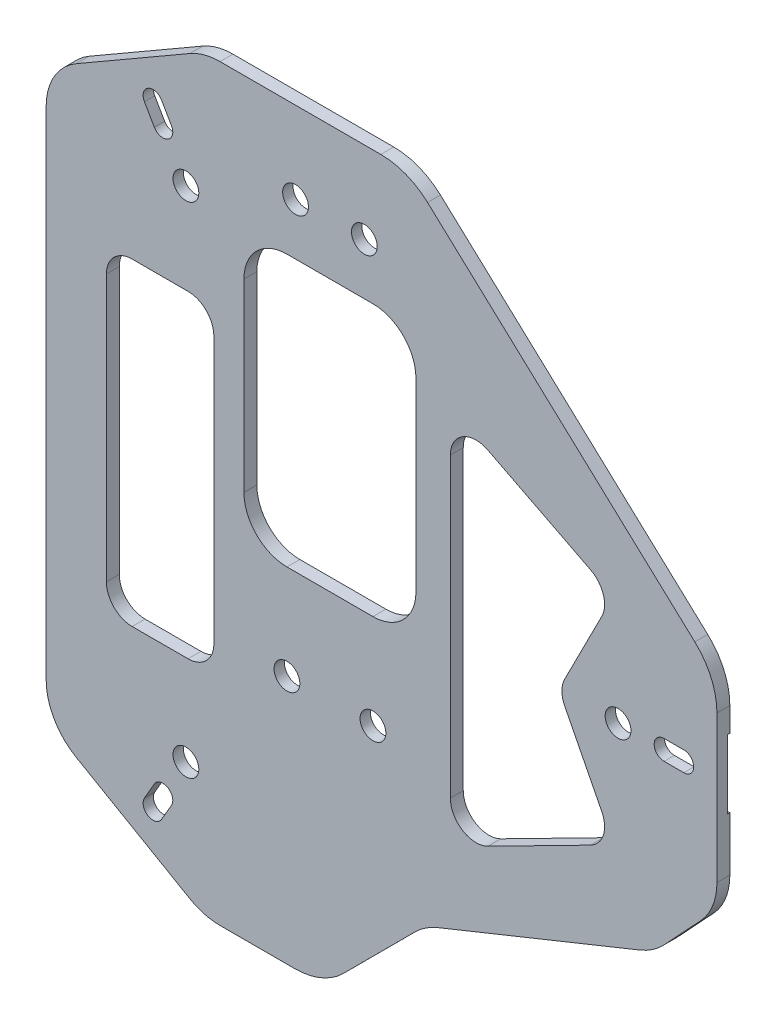
from build123d import *

# Parameters (mm, degrees)
BOSS_EXTRUDE1_DEPTH                     = 0.75
BOSS_EXTRUDE1_DEPTH_BACK                = 0.75
CORNER_RADIUS_7_R                       = 7
CORNER_RADIUS_8_R                       = 8
ALIGN_AXIS_REMAGE_ANGLE                 = 180
GROOVES_DEPTH                           = 0.3
COPPERROD_HOLES_REACH                   = 64.606
SKETCH6_R                               = 1.5
CIRPATTERN1_COUNT                       = 3
CUT_OUTS_REACH                          = 64.606
SKETCH7_W                               = 12.5
SKETCH7_H                               = 37
SKETCH7_W_2                             = 20
SKETCH7_H_2                             = 31.5
CORNER_CUTOUTS_3_R                      = 3
CORNER_CUTOUTS_5_R                      = 5
CBORE_FOR_M5_HEX_HEAD_BOLT1_D           = 3
CBORE_FOR_M5_HEX_HEAD_BOLT1_CBORE_D     = 4.5
CBORE_FOR_M5_HEX_HEAD_BOLT1_CBORE_DEPTH = 0.3


with BuildPart() as part:
    # Sketch3 → Boss-Extrude1 (new, two sides: drawn at the far end of the back side and taken through both)
    with BuildSketch(Plane.XY.offset(-BOSS_EXTRUDE1_DEPTH_BACK)):
        Polygon((-33, 0), (-33, 32.91), (-14.657581948, 43.5), (-0.777581948, 43.5), (11.04795908, 31.651617013), (37.661697646, 20.909228101), (45, 13.039862272), (45, -10.290137728), (9.052418052, -43.5), (-14.657581948, -43.5), (-33, -32.91), align=None)
    extrude(amount=BOSS_EXTRUDE1_DEPTH + BOSS_EXTRUDE1_DEPTH_BACK)

    # Corner_Radius_7
    corner_radius_7_edges = [part.edges().sort_by_distance(p)[0] for p in [
        (45, 13.039862272, 0),
        (-33, 32.91, 0),
        (-14.657581948, 43.5, 0),
        (-14.657581948, -43.5, 0),
        (-33, -32.91, 0),
    ]]
    fillet(corner_radius_7_edges, radius=CORNER_RADIUS_7_R)

    # Corner_Radius_8
    corner_radius_8_edges = [part.edges().sort_by_distance(p)[0] for p in [
        (9.052418052, -43.5, 0),
        (45, -10.290137728, 0),
        (37.661697646, 20.909228101, 0),
        (-0.777581948, 43.5, 0),
        (11.04795908, 31.651617013, 0),
    ]]
    fillet(corner_radius_8_edges, radius=CORNER_RADIUS_8_R)


with BuildPart() as part_1:
    # Align_axis_remage: moved
    add(part.part.rotate(Axis((0, 0, 0), (1, 0, 0)), ALIGN_AXIS_REMAGE_ANGLE))

    # Sketch5 → Grooves (cut)
    with BuildSketch(Plane.XY.offset(-0.75)):
        with BuildLine():
            Line((30, 2.5), (30, -2.5))
            ThreePointArc((30, -2.5), (30.439339828, -3.560660172), (31.5, -4))
            Line((31.5, -4), (45, -4))
            Line((45, -4), (45, 4))
            Line((45, 4), (31.5, 4))
            ThreePointArc((31.5, 4), (30.439339828, 3.560660172), (30, 2.5))
        make_face()
    grooves = extrude(amount=GROOVES_DEPTH, mode=Mode.SUBTRACT)

    # Sketch6 → CopperRod_Holes (cut, up to next)
    with BuildSketch(Plane.XY.offset(0.75), mode=Mode.PRIVATE) as copperrod_holes_sk1:
        with BuildLine():
            ThreePointArc((38.85, 1.15), (37.7, 0), (38.85, -1.15))
            Line((38.85, -1.15), (41.15, -1.15))
            ThreePointArc((41.15, -1.15), (42.3, 0), (41.15, 1.15))
            Line((41.15, 1.15), (38.85, 1.15))
        make_face()
    copperrod_holes_tool1 = extrude(copperrod_holes_sk1.sketch, amount=-COPPERROD_HOLES_REACH, mode=Mode.PRIVATE) & part_1.part
    # Sketch6 → CopperRod_Holes (cut, up to next)
    with BuildSketch(Plane.XY.offset(0.75), mode=Mode.PRIVATE) as copperrod_holes_sk2:
        with Locations((33.5, 0)):
            Circle(SKETCH6_R)
    copperrod_holes_tool2 = extrude(copperrod_holes_sk2.sketch, amount=-COPPERROD_HOLES_REACH, mode=Mode.PRIVATE) & part_1.part
    copperrod_holes_1 = copperrod_holes_tool1.solids().sort_by_distance((40, 0, 0.75))[0]
    add(copperrod_holes_1, mode=Mode.SUBTRACT)
    copperrod_holes_2 = copperrod_holes_tool2.solids().sort_by_distance((33.5, 0, 0.75))[0]
    add(copperrod_holes_2, mode=Mode.SUBTRACT)
    copperrod_holes = copperrod_holes_1 + copperrod_holes_2  # CopperRod_Holes as one shape, for the pattern or mirror that repeats it

    # CirPattern1: Grooves, CopperRod_Holes ×3 about axis
    cirpattern1_axis = Axis((0, 0, -0.825), (0, 0, 1))
    add([grooves.rotate(cirpattern1_axis, i * 360 / CIRPATTERN1_COUNT) for i in range(1, CIRPATTERN1_COUNT)], mode=Mode.SUBTRACT)
    add([copperrod_holes.rotate(cirpattern1_axis, i * 360 / CIRPATTERN1_COUNT) for i in range(1, CIRPATTERN1_COUNT)], mode=Mode.SUBTRACT)

    # Sketch7 → Cut-Outs (cut, up to next)
    with BuildSketch(Plane.XY.offset(0.75), mode=Mode.PRIVATE) as cut_outs_sk1:
        with Locations((-19.75, 0)):
            Rectangle(SKETCH7_W, SKETCH7_H)
    cut_outs_tool1 = extrude(cut_outs_sk1.sketch, amount=-CUT_OUTS_REACH, mode=Mode.PRIVATE) & part_1.part
    # Sketch7 → Cut-Outs (cut, up to next)
    with BuildSketch(Plane.XY.offset(0.75), mode=Mode.PRIVATE) as cut_outs_sk2:
        Polygon((14, 22.17), (14, -22.17), (32.9695289, -12.504542261), (26.607349804, 0), (32.9695289, 12.504542261), align=None)
    cut_outs_tool2 = extrude(cut_outs_sk2.sketch, amount=-CUT_OUTS_REACH, mode=Mode.PRIVATE) & part_1.part
    # Sketch7 → Cut-Outs (cut, up to next)
    with BuildSketch(Plane.XY.offset(0.75), mode=Mode.PRIVATE) as cut_outs_sk3:
        with Locations((0, 12.25)):
            Rectangle(SKETCH7_W_2, SKETCH7_H_2)
    cut_outs_tool3 = extrude(cut_outs_sk3.sketch, amount=-CUT_OUTS_REACH, mode=Mode.PRIVATE) & part_1.part
    add(cut_outs_tool1.solids().sort_by_distance((-19.75, 0, 0.75))[0], mode=Mode.SUBTRACT)
    add(cut_outs_tool2.solids().sort_by_distance((21.468988, 0, 0.75))[0], mode=Mode.SUBTRACT)
    add(cut_outs_tool3.solids().sort_by_distance((0, 12.25, 0.75))[0], mode=Mode.SUBTRACT)

    # Corner_CutOuts_3
    corner_cutouts_3_edges = [part_1.edges().sort_by_distance(p)[0] for p in [
        (-26, -18.5, 0),
        (-13.5, -18.5, 0),
        (-26, 18.5, 0),
        (-13.5, 18.5, 0),
        (26.607349804, 0, 0),
        (14, -22.17, 0),
        (14, 22.17, 0),
        (32.9695289, -12.504542261, 0),
        (32.9695289, 12.504542261, 0),
    ]]
    fillet(corner_cutouts_3_edges, radius=CORNER_CUTOUTS_3_R)

    # Corner_CutOuts_5
    corner_cutouts_5_edges = [part_1.edges().sort_by_distance(p)[0] for p in [
        (-10, -3.5, 0),
        (10, -3.5, 0),
        (-10, 28, 0),
        (10, 28, 0),
    ]]
    fillet(corner_cutouts_5_edges, radius=CORNER_CUTOUTS_5_R)

    # CBORE for M5 Hex Head Bolt1 (through all)
    with Locations(Plane(origin=(5, -14.5, -0.75), x_dir=(0, -1, 0), z_dir=(0, 0, -1))):
        with Locations((0, 0), (0, 10), (-48.5, 1), (-48.5, 9)):
            CounterBoreHole(CBORE_FOR_M5_HEX_HEAD_BOLT1_D / 2, CBORE_FOR_M5_HEX_HEAD_BOLT1_CBORE_D / 2, CBORE_FOR_M5_HEX_HEAD_BOLT1_CBORE_DEPTH)


solid = part_1.part
